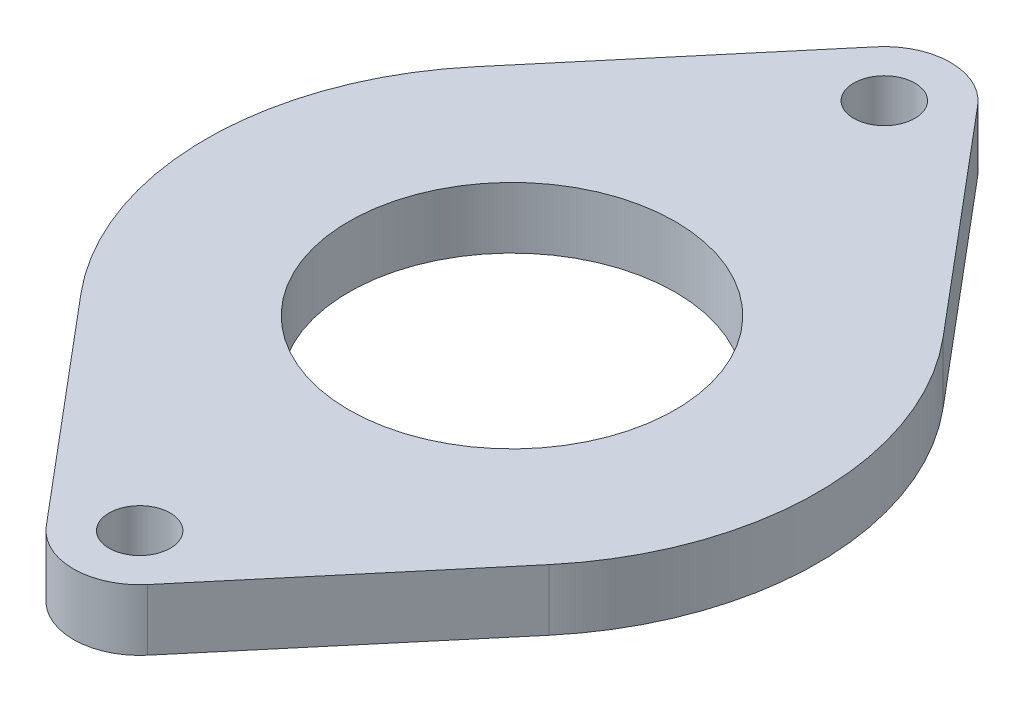
from build123d import *

# Parameters (mm, degrees)
SKETCH1_R           = 1.5
SKETCH1_R_2         = 8
BOSS_EXTRUDE1_DEPTH = 3


with BuildPart() as part:
    # Sketch1 → Boss-Extrude1 (new body)
    with BuildSketch(Plane(origin=(0, 0, 0), x_dir=(1, 0, 0), z_dir=(0, 1, 0))):
        with BuildLine():
            ThreePointArc((-2.486782474, -20.342465753), (0, -21.5), (2.486782474, -20.342465753))
            Line((2.486782474, -20.342465753), (11.47745757, -9.657534247))
            ThreePointArc((11.47745757, -9.657534247), (15, 0), (11.47745757, 9.657534247))
            Line((11.47745757, 9.657534247), (2.486782474, 20.342465753))
            ThreePointArc((2.486782474, 20.342465753), (0, 21.5), (-2.486782474, 20.342465753))
            Line((-2.486782474, 20.342465753), (-11.47745757, 9.657534247))
            ThreePointArc((-11.47745757, 9.657534247), (-15, 0), (-11.47745757, -9.657534247))
            Line((-11.47745757, -9.657534247), (-2.486782474, -20.342465753))
        make_face()
        with Locations((0, -18.25)):
            Circle(SKETCH1_R, mode=Mode.SUBTRACT)
        Circle(SKETCH1_R_2, mode=Mode.SUBTRACT)
        with Locations((0, 18.25)):
            Circle(SKETCH1_R, mode=Mode.SUBTRACT)
    extrude(amount=BOSS_EXTRUDE1_DEPTH)


solid = part.part
